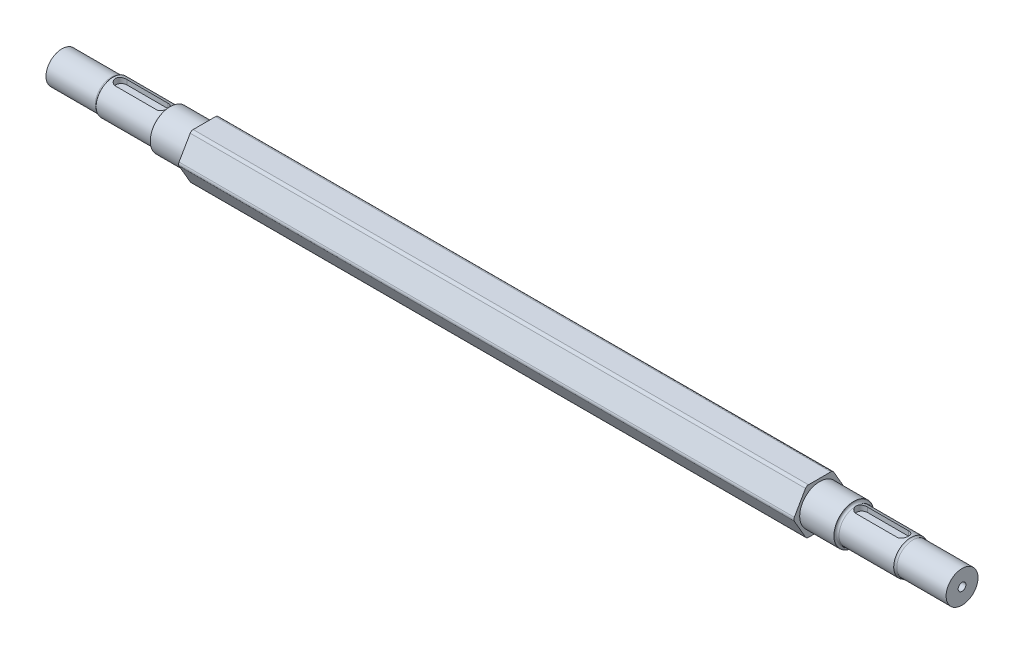
from build123d import *

# Parameters (mm, degrees)
BOSS_EXTRUDE1_DEPTH  = 270
FILLET1_R            = 2
CUT_EXTRUDE1_DEPTH   = 5
FILLET1_OF_MIRROR1_R = 2
FILLET2_R            = 3


with BuildPart() as part:
    # Sketch1 → Boss-Extrude1 (new, symmetric)
    with BuildSketch(Plane(origin=(0, 0, 0), x_dir=(0, 0, -1), z_dir=(1, 0, 0))):
        Polygon((23.094010768, 0), (11.547005384, 20), (-11.547005384, 20), (-23.094010768, 0), (-11.547005384, -20), (11.547005384, -20), align=None)
    extrude(amount=BOSS_EXTRUDE1_DEPTH, both=True)

    # Sketch2 → Revolve1 (revolve)
    with BuildSketch(Plane.XY):
        Polygon((270, 17.5), (300, 17.5), (300, 15), (350, 15), (350, 14), (395, 14), (395, 0), (270, 0), align=None)
    revolve1 = revolve(axis=Axis((395, 0, 0), (-1, 0, 0)))

    # Fillet1
    # the kernel refuses this fillet: 2 mm, written as the material it adds along each edge
    with BuildSketch(Plane(origin=(300, 0, 0), x_dir=(0, 1, 0), z_dir=(0, 0, 1))) as fillet1_piece_1:
        with BuildLine():
            CenterArc((15 + FILLET1_R, -FILLET1_R), FILLET1_R, 90, 90)
            Line((15, -FILLET1_R), (15 - FILLET1_R * 0.02, -FILLET1_R))
            Line((15 - FILLET1_R * 0.02, -FILLET1_R), (15 - FILLET1_R * 0.02, FILLET1_R * 0.02))
            Line((15 - FILLET1_R * 0.02, FILLET1_R * 0.02), (15 + FILLET1_R, FILLET1_R * 0.02))
            Line((15 + FILLET1_R, FILLET1_R * 0.02), (15 + FILLET1_R, 0))
        make_face()
    revolve(axis=Axis((300, 0, 0), (-1, 0, 0)))
    with BuildSketch(Plane(origin=(350, 0, 0), x_dir=(0, 1, 0), z_dir=(0, 0, 1))) as fillet1_piece_2:
        with BuildLine():
            CenterArc((16, -1.732050808), FILLET1_R, 120, 60)
            Line((14, -1.732050808), (13.96, -1.732050808))
            Line((13.96, -1.732050808), (13.96, 0))
            Line((13.96, 0), (14, 0.04))
            ThreePointArc((14, 0.04), (14.5, 0.04), (14.98, 0.034641016))
            Line((14.98, 0.034641016), (15, 0))
        make_face()
    revolve(axis=Axis((350, 0, 0), (-1, 0, 0)))

    # Sketch3 → Cut-Extrude1 (cut)
    with BuildSketch(Plane(origin=(0, 15, 0), x_dir=(1, 0, 0), z_dir=(0, 1, 0))):
        with BuildLine():
            Line((307, 5), (343, 5))
            ThreePointArc((343, 5), (348, 0), (343, -5))
            Line((343, -5), (307, -5))
            ThreePointArc((307, -5), (302, 0), (307, 5))
        make_face()
    cut_extrude1 = extrude(amount=-CUT_EXTRUDE1_DEPTH, mode=Mode.SUBTRACT)

    # Mirror1: Revolve1, Cut-Extrude1 across plane
    add(revolve1.mirror(Plane(origin=(0, 0, 0), x_dir=(0, 0, 1), z_dir=(1, 0, 0))))
    add(cut_extrude1.mirror(Plane(origin=(0, 0, 0), x_dir=(0, 0, 1), z_dir=(1, 0, 0))), mode=Mode.SUBTRACT)

    # Fillet1 of Mirror1
    # the kernel refuses this fillet: 2 mm, written as the material it adds along each edge
    with BuildSketch(Plane(origin=(-300, 0, 0), x_dir=(0, 1, 0), z_dir=(0, 0, 1))) as fillet1_of_mirror1_piece_1:
        with BuildLine():
            CenterArc((15 + FILLET1_OF_MIRROR1_R, FILLET1_OF_MIRROR1_R), FILLET1_OF_MIRROR1_R, 180, 90)
            Line((15, FILLET1_OF_MIRROR1_R), (15 - FILLET1_OF_MIRROR1_R * 0.02, FILLET1_OF_MIRROR1_R))
            Line((15 - FILLET1_OF_MIRROR1_R * 0.02, FILLET1_OF_MIRROR1_R), (15 - FILLET1_OF_MIRROR1_R * 0.02, -FILLET1_OF_MIRROR1_R * 0.02))
            Line((15 - FILLET1_OF_MIRROR1_R * 0.02, -FILLET1_OF_MIRROR1_R * 0.02), (15 + FILLET1_OF_MIRROR1_R, -FILLET1_OF_MIRROR1_R * 0.02))
            Line((15 + FILLET1_OF_MIRROR1_R, -FILLET1_OF_MIRROR1_R * 0.02), (15 + FILLET1_OF_MIRROR1_R, 0))
        make_face()
    revolve(axis=Axis((-300, 0, 0), (-1, 0, 0)))
    with BuildSketch(Plane(origin=(-350, 0, 0), x_dir=(0, 1, 0), z_dir=(0, 0, 1))) as fillet1_of_mirror1_piece_2:
        with BuildLine():
            CenterArc((16, 1.732050808), FILLET1_OF_MIRROR1_R, 180, 60)
            Line((14, 1.732050808), (13.96, 1.732050808))
            Line((13.96, 1.732050808), (13.96, 0))
            Line((13.96, 0), (14, -0.04))
            ThreePointArc((14, -0.04), (14.5, -0.04), (14.98, -0.034641016))
            Line((14.98, -0.034641016), (15, 0))
        make_face()
    revolve(axis=Axis((-350, 0, 0), (-1, 0, 0)))

    # Fillet2
    fillet2_edges = [part.edges().sort_by_distance(p)[0] for p in [
        (0, -20, -11.547005384),
        (0, -20, 11.547005384),
        (0, 0, 23.094010768),
        (0, 20, 11.547005384),
        (0, 20, -11.547005384),
        (0, 0, -23.094010768),
    ]]
    fillet(fillet2_edges, radius=FILLET2_R)

    # Sketch5 → Tap Drill for M8 Tap1 (revolve, cut)
    with BuildSketch(Plane(origin=(395, 0, 0), x_dir=(0, 0, -1), z_dir=(0, 1, 0))):
        Polygon((0, 0), (0, 27.5), (3.4, 25.457073895), (3.4, 0.025), (3.425, 0), align=None)
    tap_drill_for_m8_tap1 = revolve(axis=Axis((401.35, 0, 0), (-1, 0, 0)), mode=Mode.SUBTRACT)

    # Mirror2: Tap Drill for M8 Tap1 across plane
    add(tap_drill_for_m8_tap1.mirror(Plane(origin=(0, 0, 0), x_dir=(0, 0, 1), z_dir=(1, 0, 0))), mode=Mode.SUBTRACT)


solid = part.part
